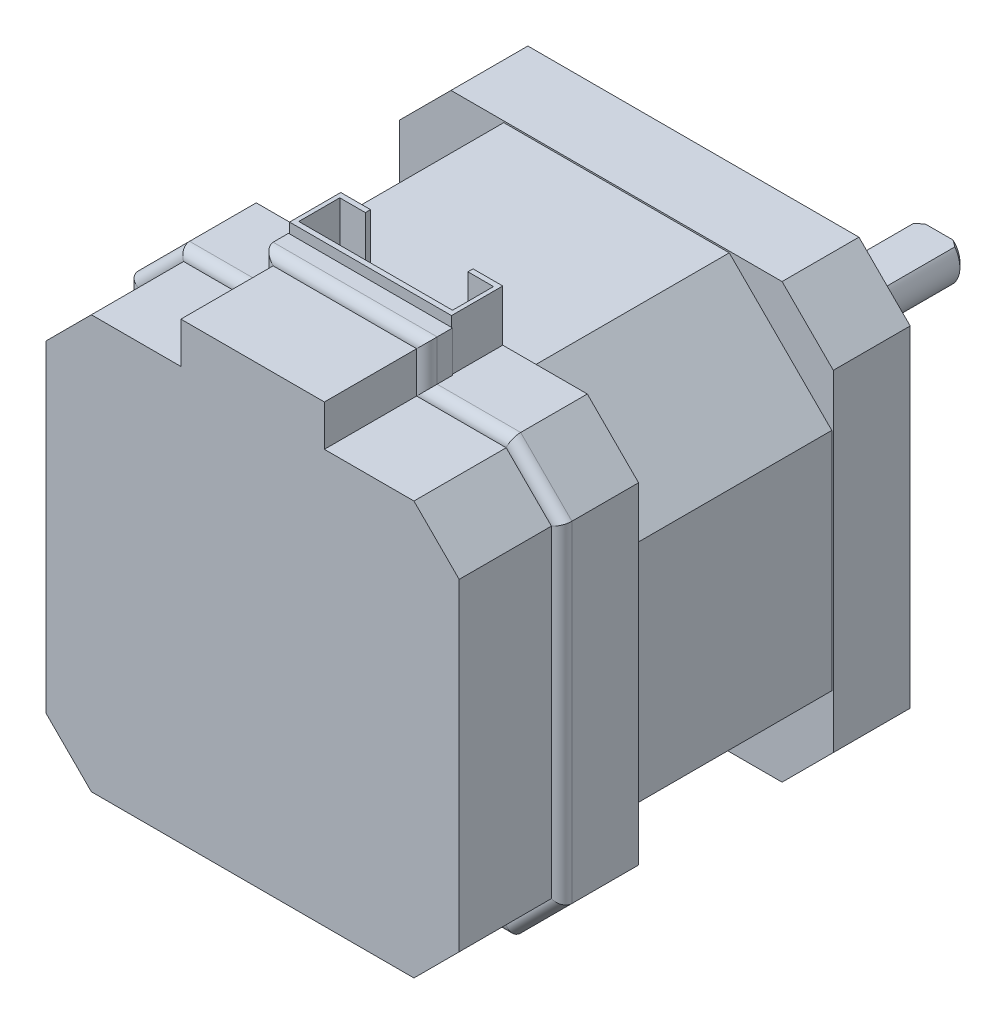
from build123d import *

# Parameters (mm, degrees)
SKETCH_1_W          = 42
SKETCH_1_H          = 42
EXTRUDE_1_DEPTH     = 19
CHAMFER_1_SIZE      = 10
SKETCH_2_W          = 42.3
SKETCH_2_H          = 42.3
EXTRUDE_2_DEPTH     = 7.5
SKETCH_3_W          = 42.3
SKETCH_3_H          = 42.3
EXTRUDE_3_DEPTH     = 7.5
CHAMFER_2_SIZE      = 5
SKETCH_4_R          = 1.5
CUT_EXTRUDE_1_DEPTH = 4.5
SKETCH_5_R          = 11
SKETCH_5_R_2        = 3.75
EXTRUDE_4_DEPTH     = 2
SKETCH_6_R          = 2.5
EXTRUDE_5_DEPTH     = 24
CUT_EXTRUDE_START   = -19
CUT_EXTRUDE_2_DEPTH = 19
CHAMFER_3_SIZE      = 0.5
EXTRUDE_6_DEPTH     = 2.5
FILLET_1_R          = 1
EXTRUDE_7_DEPTH     = 5
EXTRUDE_8_DEPTH     = 9
CHAMFER_4_SIZE      = 2.5


with BuildPart() as part:
    # 草图1 → 凸台-拉伸1 (new body)
    with BuildSketch(Plane.XY):
        Rectangle(SKETCH_1_W, SKETCH_1_H)
    extrude(amount=EXTRUDE_1_DEPTH)

    # 倒角1
    chamfer_1_edges = [part.edges().sort_by_distance(p)[0] for p in [
        (21, -21, 9.5),
        (-21, -21, 9.5),
        (-21, 21, 9.5),
        (21, 21, 9.5),
    ]]
    chamfer(chamfer_1_edges, length=CHAMFER_1_SIZE)

    # 草图2 → 凸台-拉伸2 (add)
    with BuildSketch(Plane.XY.offset(19)):
        Rectangle(SKETCH_2_W, SKETCH_2_H)
    extrude(amount=EXTRUDE_2_DEPTH)

    # 草图3 → 凸台-拉伸3 (add)
    with BuildSketch(Plane(origin=(0, 0, 0), x_dir=(-1, 0, 0), z_dir=(0, 0, -1))):
        Rectangle(SKETCH_3_W, SKETCH_3_H)
    extrude(amount=EXTRUDE_3_DEPTH)

    # 倒角2
    chamfer_2_edges = [part.edges().sort_by_distance(p)[0] for p in [
        (21.15, -21.15, 22.75),
        (21.15, 21.15, 22.75),
        (-21.15, 21.15, 22.75),
        (-21.15, -21.15, 22.75),
        (-21.15, -21.15, -3.75),
        (-21.15, 21.15, -3.75),
        (21.15, 21.15, -3.75),
        (21.15, -21.15, -3.75),
    ]]
    chamfer(chamfer_2_edges, length=CHAMFER_2_SIZE)

    # 草图4 → 切除-拉伸1 (cut)
    with BuildSketch(Plane(origin=(0, 0, -7.5), x_dir=(-1, 0, 0), z_dir=(0, 0, -1))):
        with Locations((-15.5, 15.5)):
            Circle(SKETCH_4_R)
        with Locations((15.5, 15.5)):
            Circle(SKETCH_4_R)
        with Locations((15.5, -15.5)):
            Circle(SKETCH_4_R)
        with Locations((-15.5, -15.5)):
            Circle(SKETCH_4_R)
    extrude(amount=-CUT_EXTRUDE_1_DEPTH, mode=Mode.SUBTRACT)

    # 草图5 → 凸台-拉伸4 (add)
    with BuildSketch(Plane(origin=(0, 0, -7.5), x_dir=(-1, 0, 0), z_dir=(0, 0, -1))):
        Circle(SKETCH_5_R)
        Circle(SKETCH_5_R_2, mode=Mode.SUBTRACT)
    extrude(amount=EXTRUDE_4_DEPTH)

    # 草图6 → 凸台-拉伸5 (add)
    with BuildSketch(Plane(origin=(0, 0, -7.5), x_dir=(-1, 0, 0), z_dir=(0, 0, -1))):
        Circle(SKETCH_6_R)
    extrude(amount=EXTRUDE_5_DEPTH)

    # 草图7 → 切除-拉伸2 (cut)
    with BuildSketch(Plane(origin=(0, 0, -31.5), x_dir=(-1, 0, 0), z_dir=(0, 0, -1)).offset(CUT_EXTRUDE_START)):
        with BuildLine():
            Line((2, 1.5), (-2, 1.5))
            ThreePointArc((-2, 1.5), (0, 2.5), (2, 1.5))
        make_face()
    extrude(amount=CUT_EXTRUDE_2_DEPTH, mode=Mode.SUBTRACT)

    # 倒角3
    chamfer_3_edges = [part.edges().sort_by_distance(p)[0] for p in [
        (0.790569415, -2.371708245, -31.5),
    ]]
    chamfer(chamfer_3_edges, length=CHAMFER_3_SIZE)

    # 草图8 → 凸台-拉伸6 (add)
    with BuildSketch(Plane.XY.offset(26.5)):
        Polygon((0, 21.15), (-8, 21.15), (-8, 25.15), (8, 25.15), (8, 21.15), align=None)
    extrude(amount=-EXTRUDE_6_DEPTH)

    # 圆角1
    fillet_1_edges = [part.edges().sort_by_distance(p)[0] for p in [
        (-12.075, 21.15, 26.5),
        (8, 23.15, 26.5),
        (0, 25.15, 26.5),
        (-8, 23.15, 26.5),
        (0, -21.15, 26.5),
        (-21.15, 0, 26.5),
        (21.15, 0, 26.5),
        (12.075, 21.15, 26.5),
        (-18.65, 18.65, 26.5),
        (18.65, 18.65, 26.5),
        (18.65, -18.65, 26.5),
        (-18.65, -18.65, 26.5),
    ]]
    fillet(fillet_1_edges, radius=FILLET_1_R)

    # 草图9 → 凸台-拉伸7 (add)
    with BuildSketch(Plane(origin=(0, 21.15, 0), x_dir=(1, 0, 0), z_dir=(0, 1, 0))):
        Polygon((7.9, -19), (5, -19), (5, -19.5), (7.5, -19.5), (7.5, -23.5), (-7.5, -23.5), (-7.5, -19.5), (-5, -19.5), (-5, -19), (-7.9, -19), (-7.9, -24), (7.9, -24), align=None)
    extrude(amount=EXTRUDE_7_DEPTH)

    # 草图10 → 凸台-拉伸8 (add)
    with BuildSketch(Plane.XY.offset(26.5)):
        Polygon((-7, 20.15), (-15.735786438, 20.15), (-20.15, 15.735786438), (-20.15, -15.735786438), (-15.735786438, -20.15), (15.735786438, -20.15), (20.15, -15.735786438), (20.15, 15.735786438), (15.735786438, 20.15), (7, 20.15), (7, 24.15), (-7, 24.15), align=None)
    extrude(amount=EXTRUDE_8_DEPTH)

    # 倒角4
    # the kernel refuses this chamfer: 2.5 mm, written as the material it adds along each edge
    with BuildSketch(Plane(origin=(0, 0, -7.5), x_dir=(-1, 0, 0), z_dir=(0, -1, 0))) as chamfer_4_piece_1:
        Polygon((2.5 + CHAMFER_4_SIZE, 0), (2.5, CHAMFER_4_SIZE), (2.5, 0), align=None)
    revolve(axis=Axis((0, 0, -7.5), (0, 0, -1)))


solid = part.part
